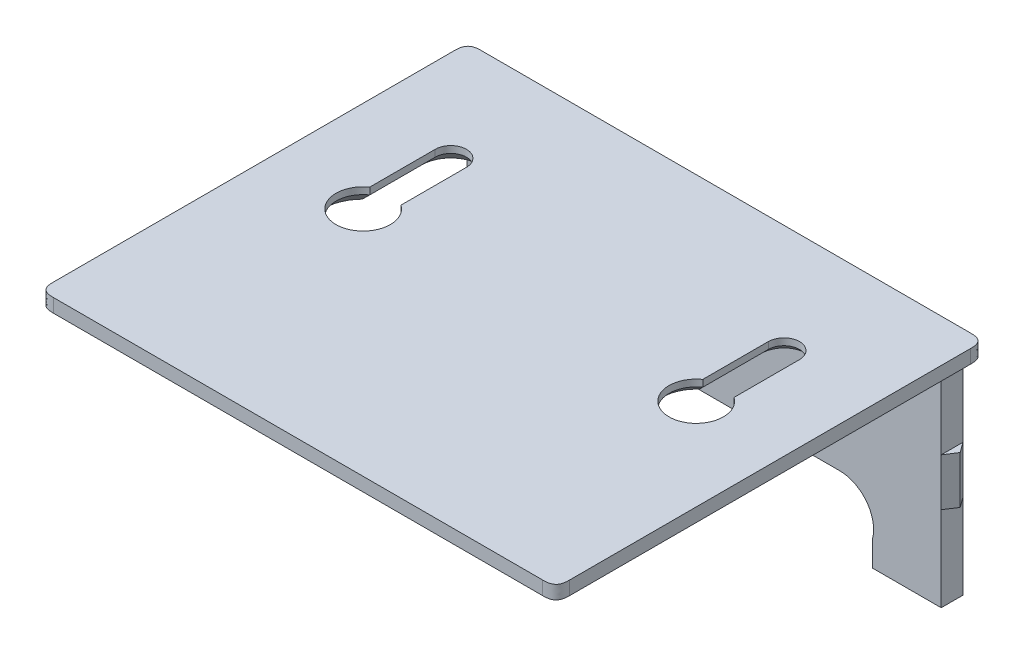
from build123d import *

# Parameters (mm, degrees)
SKETCH1_W               = 76
SKETCH1_H               = 63
BOSS_EXTRUDE1_DEPTH     = 2
SKETCH2_W               = 69.6
SKETCH2_H               = 56.6
BOSS_EXTRUDE2_DEPTH     = 1
SKETCH3_W               = 69.8
SKETCH3_H               = 3.2
BOSS_EXTRUDE3_DEPTH     = 32
BOSS_EXTRUDE4_DEPTH     = 3.5
BOSS_EXTRUDE5_DEPTH     = 3.5
BOSS_EXTRUDE6_DEPTH     = 3.5
CUT_EXTRUDE1_DEPTH      = 7
CHAMFER1_SIZE           = 2
FILLET1_SIZE            = 2
CUT_EXTRUDE2_DEPTH      = 81.23091686
CUT_EXTRUDE2_DEPTH_BACK = 3.2
SKETCH8_R               = 7
SKETCH8_W               = 12
SKETCH8_H               = 9
SKETCH9_W               = 17.861030929
SKETCH9_H               = 28
CUT_EXTRUDE3_DEPTH      = 1
SKETCH10_W              = 69.6
SKETCH10_H              = 8
CUT_EXTRUDE4_DEPTH      = 2
CHAMFER2_SIZE2          = 1
CHAMFER2_SIZE           = 1.732050808
CUT_EXTRUDE5_DEPTH      = 3.2


# Some blends are built 0.0001 mm under size
with BuildPart() as part:
    # Sketch1 → Boss-Extrude1 (new body)
    with BuildSketch(Plane(origin=(0, 0, 0), x_dir=(1, 0, 0), z_dir=(0, 1, 0))):
        Rectangle(SKETCH1_W, SKETCH1_H)
    extrude(amount=BOSS_EXTRUDE1_DEPTH)

    # Sketch2 → Boss-Extrude2 (add)
    with BuildSketch(Plane(origin=(0, 0, 0), x_dir=(1, 0, 0), z_dir=(0, 1, 0))):
        Rectangle(SKETCH2_W, SKETCH2_H)
    extrude(amount=-BOSS_EXTRUDE2_DEPTH)

    # Sketch3 → Boss-Extrude3 (add)
    with BuildSketch(Plane.XZ):
        with Locations((0, -29.9)):
            Rectangle(SKETCH3_W, SKETCH3_H)
    extrude(amount=BOSS_EXTRUDE3_DEPTH)

    # Sketch4 → Boss-Extrude4 (add, symmetric)
    with BuildSketch(Plane.XY.offset(-1.5)):
        Polygon((-34.8, 0), (-36, -1.5), (-34.8, -3), (-33.3, -3), (-33.3, 0), align=None)
        Polygon((33.3, 0), (34.8, 0), (36, -1.5), (34.8, -3), (33.3, -3), align=None)
    extrude(amount=BOSS_EXTRUDE4_DEPTH, both=True)

    # Sketch5 → Boss-Extrude5 (add, symmetric)
    with BuildSketch(Plane(origin=(0, 0, 0), x_dir=(0, 0, -1), z_dir=(1, 0, 0))):
        Polygon((-28.3, 0), (-29.5, -1.5), (-28.3, -3), (-27.3, -3), (-27.3, 0), align=None)
    extrude(amount=BOSS_EXTRUDE5_DEPTH, both=True)

    # Sketch6 → Boss-Extrude6 (add, symmetric)
    with BuildSketch(Plane(origin=(0, -16, 0), x_dir=(-1, 0, 0), z_dir=(0, -1, 0))):
        Polygon((-34.9, 31.5), (-36, 30), (-34.9, 28.3), align=None)
        Polygon((34.9, 28.3), (34.9, 31.5), (36, 30), align=None)
    extrude(amount=BOSS_EXTRUDE6_DEPTH, both=True)

    # Sketch7 → Cut-Extrude1 (cut)
    with BuildSketch(Plane.XZ.offset(1)):
        with BuildLine():
            Line((-26.822034097, -5.879323383), (-26.822034097, -15.516493675))
            ThreePointArc((-26.822034097, -15.516493675), (-24.522034097, -17.816493675), (-22.222034097, -15.516493675))
            Line((-22.222034097, -15.516493675), (-22.222034097, -5.879323383))
            ThreePointArc((-22.222034097, -5.879323383), (-24.522034097, 1.393290251), (-26.822034097, -5.879323383))
        make_face()
        with BuildLine():
            Line((22.222034097, -5.879323383), (22.222034097, -15.516493675))
            ThreePointArc((22.222034097, -15.516493675), (24.522034097, -17.816493675), (26.822034097, -15.516493675))
            Line((26.822034097, -15.516493675), (26.822034097, -5.879323383))
            ThreePointArc((26.822034097, -5.879323383), (24.522034097, 1.393290251), (22.222034097, -5.879323383))
        make_face()
    extrude(amount=-CUT_EXTRUDE1_DEPTH, mode=Mode.SUBTRACT)

    # Chamfer1
    chamfer1_edges = [part.edges().sort_by_distance(p)[0] for p in [
        (-24.522034097, -1, 1.393290251),
        (-26.822034097, -1, -10.697908529),
        (-24.522034097, -1, -17.816493675),
        (-22.222034097, -1, -10.697908529),
        (24.522034097, -1, -17.816493675),
        (26.822034097, -1, -10.697908529),
        (24.522034097, -1, 1.393290251),
        (22.222034097, -1, -10.697908529),
    ]]
    chamfer(chamfer1_edges, length=CHAMFER1_SIZE)

    # Fillet1
    # a fillet whose section is not a circle: 2 mm, written as the material it takes off along each edge
    with BuildSketch(Plane(origin=(38, -5, 31.5), x_dir=(0, 0, -1), z_dir=(0, 1, 0)), Plane(origin=(38, -5, -31.5), x_dir=(-1, 0, 0), z_dir=(0, 1, 0))) as fillet1_piece_1:
        with BuildLine():
            add(Edge.make_bspline([(FILLET1_SIZE, 0), (FILLET1_SIZE * 0.831801948466, 0), (FILLET1_SIZE * 0.663603896932, 0), (FILLET1_SIZE * 0.292893218813, FILLET1_SIZE * 0.0716919198361), (FILLET1_SIZE * 0.0716919198361, FILLET1_SIZE * 0.292893218813), (0, FILLET1_SIZE * 0.663603896932), (0, FILLET1_SIZE * 0.831801948466), (0, FILLET1_SIZE)], knots=[0, 0, 0, 0, 0, 0, 0.5, 0.5, 1, 1, 1, 1, 1, 1], degree=5))
            Line((0, FILLET1_SIZE), (0, 0))
            Line((0, 0), (FILLET1_SIZE, 0))
        make_face()
    extrude(amount=12, mode=Mode.SUBTRACT)
    with BuildSketch(Plane(origin=(-38, -5, 31.5), x_dir=(0, 0, -1), z_dir=(0, 1, 0)), Plane(origin=(-38, -5, -31.5), x_dir=(1, 0, 0), z_dir=(0, 1, 0))) as fillet1_piece_2:
        with BuildLine():
            add(Edge.make_bspline([(FILLET1_SIZE, 0), (FILLET1_SIZE * 0.831801948466, 0), (FILLET1_SIZE * 0.663603896932, 0), (FILLET1_SIZE * 0.292893218813, -FILLET1_SIZE * 0.0716919198361), (FILLET1_SIZE * 0.0716919198361, -FILLET1_SIZE * 0.292893218813), (0, -FILLET1_SIZE * 0.663603896932), (0, -FILLET1_SIZE * 0.831801948466), (0, -FILLET1_SIZE)], knots=[0, 0, 0, 0, 0, 0, 0.5, 0.5, 1, 1, 1, 1, 1, 1], degree=5))
            Line((0, -FILLET1_SIZE), (0, 0))
            Line((0, 0), (FILLET1_SIZE, 0))
        make_face()
    extrude(amount=12, mode=Mode.SUBTRACT)

    # Sketch8 → Cut-Extrude2 (cut, two sides: drawn at the far end of the back side and taken through both)
    with BuildSketch(Plane(origin=(0, 0, -31.5), x_dir=(-1, 0, 0), z_dir=(0, 0, -1)).offset(-CUT_EXTRUDE2_DEPTH_BACK)):
        with Locations((14.4, -21.8)):
            Circle(SKETCH8_R)
        with BuildLine():
            Line((-19.95069293, -22), (-11.95069293, -22))
            ThreePointArc((-11.95069293, -22), (-6.95069293, -27), (-11.95069293, -32))
            Line((-11.95069293, -32), (-19.95069293, -32))
            ThreePointArc((-19.95069293, -32), (-24.95069293, -27), (-19.95069293, -22))
        make_face()
        with Locations((-21.4, -4)):
            Rectangle(SKETCH8_W, SKETCH8_H)
    extrude(amount=CUT_EXTRUDE2_DEPTH + CUT_EXTRUDE2_DEPTH_BACK, mode=Mode.SUBTRACT)

    # Sketch9 → Cut-Extrude3 (cut)
    with BuildSketch(Plane.XZ.offset(1)):
        with Locations((24.330515464, -14.3)):
            Rectangle(SKETCH9_W, SKETCH9_H)
    extrude(amount=-CUT_EXTRUDE3_DEPTH, mode=Mode.SUBTRACT)

    # Sketch10 → Cut-Extrude4 (cut)
    with BuildSketch(Plane.XZ.offset(1)):
        with Locations((0, 23.3)):
            Rectangle(SKETCH10_W, SKETCH10_H)
    extrude(amount=-CUT_EXTRUDE4_DEPTH, mode=Mode.SUBTRACT)

    # Chamfer2
    chamfer2_edges = [part.edges().sort_by_distance(p)[0] for p in [
        (0, -3, 27.3),
    ]]
    chamfer2_side = [part.faces().sort_by_distance(p)[0] for p in [
        (0, -2.98, 27.3),
    ]]
    chamfer(chamfer2_edges, length=CHAMFER2_SIZE - 0.0001, length2=CHAMFER2_SIZE2 - 0.0001, reference=chamfer2_side[0])  # a hair under: the kernel refuses the full size

    # Sketch11 → Cut-Extrude5 (cut)
    with BuildSketch(Plane(origin=(0, 0, -31.5), x_dir=(-1, 0, 0), z_dir=(0, 0, -1))):
        Polygon((-24.798914111, -28.222600255), (-24.798914111, -36.274254695), (17.416877144, -36.274254695), (17.416877144, -28.116522168), (7.402857726, -22), (-13.082910041, -22), (-13.082910041, -28.222600255), align=None)
    extrude(amount=-CUT_EXTRUDE5_DEPTH, mode=Mode.SUBTRACT)


solid = part.part
